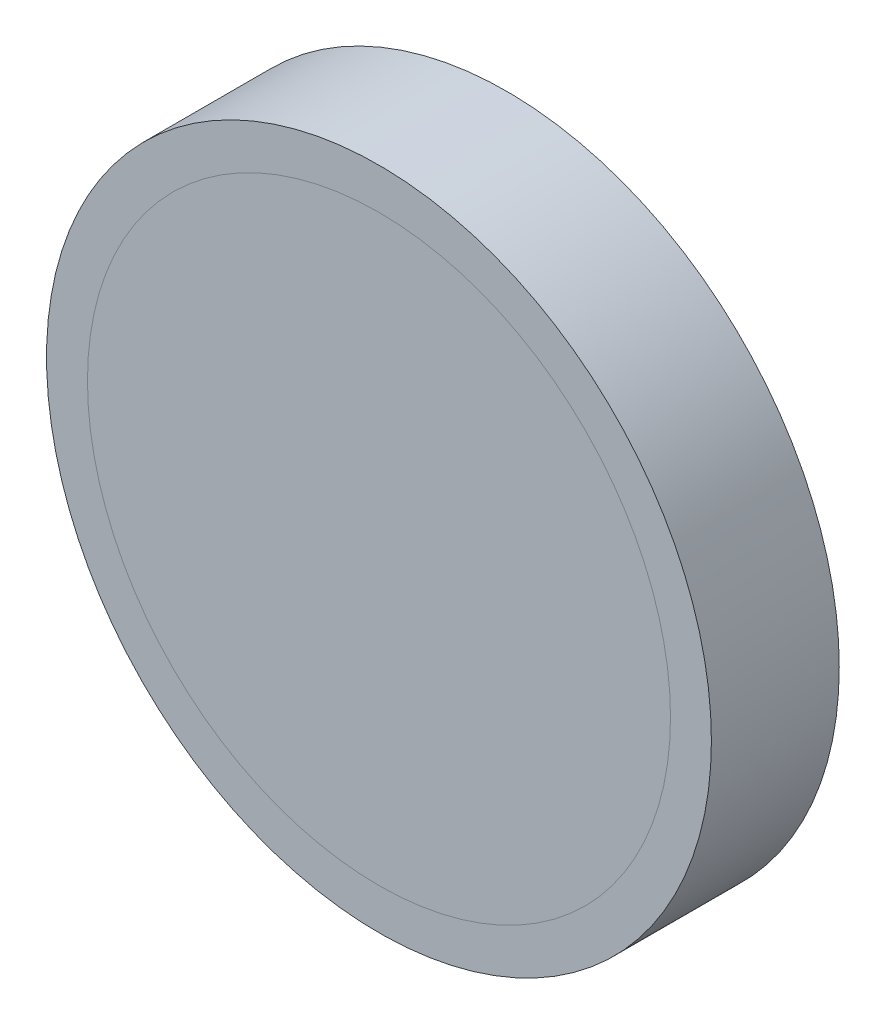
from build123d import *

# Parameters (mm, degrees)
SKETCH1_R           = 4.1275
BOSS_EXTRUDE1_DEPTH = 1.5875


with BuildPart() as part:
    # Sketch1 → Boss-Extrude1 (new body)
    with BuildSketch(Plane.XY):
        with Locations((-6.731, -165.7192297)):
            Circle(SKETCH1_R)
    extrude(amount=BOSS_EXTRUDE1_DEPTH)


solid = part.part
